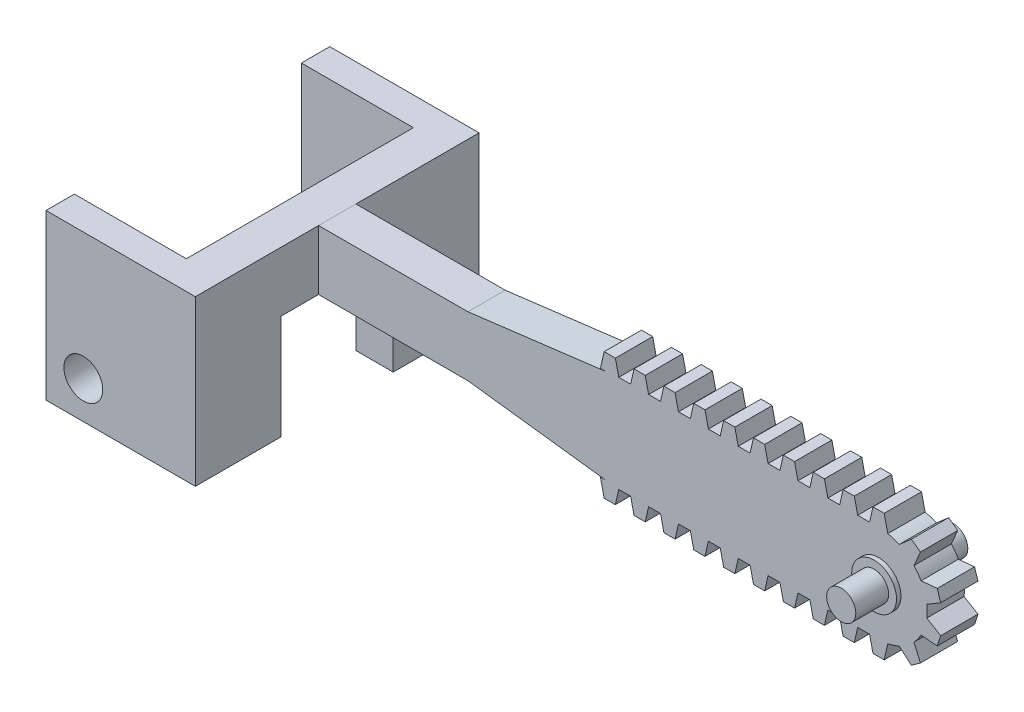
from build123d import *

# Parameters (mm, degrees)
BOSS_EXTRU_1_DEPTH           = 2.5
ESQUISSE2_R                  = 1.95
BOSS_EXTRU_2_DEPTH           = 7.5
BOSS_EXTRU_3_DEPTH           = 2.5
R_P_TITION_LIN_AIRE1_COUNT   = 10
R_P_TITION_LIN_AIRE1_PITCH   = 4
SYM_TRIE1_COPY_1_DEPTH       = 2.5
SYM_TRIE1_COPY_2_DEPTH       = 2.5
SYM_TRIE1_COPY_3_DEPTH       = 2.5
SYM_TRIE1_COPY_4_DEPTH       = 2.5
SYM_TRIE1_COPY_5_DEPTH       = 2.5
SYM_TRIE1_COPY_6_DEPTH       = 2.5
SYM_TRIE1_COPY_7_DEPTH       = 2.5
SYM_TRIE1_COPY_8_DEPTH       = 2.5
SYM_TRIE1_COPY_9_DEPTH       = 2.5
SYM_TRIE1_COPY_10_DEPTH      = 2.5
R_P_TITION_CIRCULAIRE1_COUNT = 6
R_P_TITION_CIRCULAIRE1_ANGLE = 180
ESQUISSE6_R                  = 3
BOSS_EXTRU_4_DEPTH           = 0.6
BOSS_EXTRU_5_START           = 0.6
ESQUISSE7_R                  = 3
BOSS_EXTRU_5_DEPTH           = 0.6
BOSS_EXTRU_6_DEPTH           = 22
ESQUISSE11_R                 = 2.6
ENL_V_MAT_EXTRU_5_DEPTH      = 89.17170748
ESQUISSE12_W                 = 15
ESQUISSE12_H                 = 14
ENL_V_MAT_EXTRU_6_DEPTH      = 88.329909275


with BuildPart() as part:
    # Esquisse1 → Boss.-Extru.1 (new, symmetric)
    with BuildSketch(Plane.XY):
        with BuildLine():
            Line((-17.5, 6.5), (-37.5, 4))
            Line((-37.5, 4), (-57.5, 4))
            Line((-57.5, 4), (-57.5, -4))
            Line((-57.5, -4), (-37.5, -4))
            Line((-37.5, -4), (-17.5, -6.5))
            Line((-17.5, -6.5), (17.5, -6.5))
            ThreePointArc((17.5, -6.5), (24, 0), (17.5, 6.5))
            Line((17.5, 6.5), (-17.5, 6.5))
        make_face()
    extrude(amount=BOSS_EXTRU_1_DEPTH, both=True)

    # Esquisse2 → Boss.-Extru.2 (add, symmetric)
    with BuildSketch(Plane.XY):
        with Locations((17.5, 0)):
            Circle(ESQUISSE2_R)
    extrude(amount=BOSS_EXTRU_2_DEPTH, both=True)

    # Esquisse5 → Boss.-Extru.3 (add, symmetric)
    with BuildSketch(Plane.XY):
        Polygon((16.25, -6.3), (16.75, -8.5), (18.25, -8.5), (18.75, -6.3), align=None)
    boss_extru_3 = extrude(amount=BOSS_EXTRU_3_DEPTH, both=True)

    # Répétition linéaire1: Boss.-Extru.3 ×10
    with Locations(*[(-i * R_P_TITION_LIN_AIRE1_PITCH, 0, 0) for i in range(1, R_P_TITION_LIN_AIRE1_COUNT)]):
        add(boss_extru_3)

    # Symétrie1 copy 1 sketch → Symétrie1 copy 1 (add, symmetric)
    with BuildSketch(Plane(origin=(-4, 0, 0), x_dir=(1, 0, 0), z_dir=(0, 0, 1))):
        Polygon((16.25, 6.3), (16.75, 8.5), (18.25, 8.5), (18.75, 6.3), align=None)
    extrude(amount=SYM_TRIE1_COPY_1_DEPTH, both=True)

    # Symétrie1 copy 2 sketch → Symétrie1 copy 2 (add, symmetric)
    with BuildSketch(Plane(origin=(-8, 0, 0), x_dir=(1, 0, 0), z_dir=(0, 0, 1))):
        Polygon((16.25, 6.3), (16.75, 8.5), (18.25, 8.5), (18.75, 6.3), align=None)
    extrude(amount=SYM_TRIE1_COPY_2_DEPTH, both=True)

    # Symétrie1 copy 3 sketch → Symétrie1 copy 3 (add, symmetric)
    with BuildSketch(Plane(origin=(-12, 0, 0), x_dir=(1, 0, 0), z_dir=(0, 0, 1))):
        Polygon((16.25, 6.3), (16.75, 8.5), (18.25, 8.5), (18.75, 6.3), align=None)
    extrude(amount=SYM_TRIE1_COPY_3_DEPTH, both=True)

    # Symétrie1 copy 4 sketch → Symétrie1 copy 4 (add, symmetric)
    with BuildSketch(Plane(origin=(-16, 0, 0), x_dir=(1, 0, 0), z_dir=(0, 0, 1))):
        Polygon((16.25, 6.3), (16.75, 8.5), (18.25, 8.5), (18.75, 6.3), align=None)
    extrude(amount=SYM_TRIE1_COPY_4_DEPTH, both=True)

    # Symétrie1 copy 5 sketch → Symétrie1 copy 5 (add, symmetric)
    with BuildSketch(Plane(origin=(-20, 0, 0), x_dir=(1, 0, 0), z_dir=(0, 0, 1))):
        Polygon((16.25, 6.3), (16.75, 8.5), (18.25, 8.5), (18.75, 6.3), align=None)
    extrude(amount=SYM_TRIE1_COPY_5_DEPTH, both=True)

    # Symétrie1 copy 6 sketch → Symétrie1 copy 6 (add, symmetric)
    with BuildSketch(Plane(origin=(-24, 0, 0), x_dir=(1, 0, 0), z_dir=(0, 0, 1))):
        Polygon((16.25, 6.3), (16.75, 8.5), (18.25, 8.5), (18.75, 6.3), align=None)
    extrude(amount=SYM_TRIE1_COPY_6_DEPTH, both=True)

    # Symétrie1 copy 7 sketch → Symétrie1 copy 7 (add, symmetric)
    with BuildSketch(Plane(origin=(-28, 0, 0), x_dir=(1, 0, 0), z_dir=(0, 0, 1))):
        Polygon((16.25, 6.3), (16.75, 8.5), (18.25, 8.5), (18.75, 6.3), align=None)
    extrude(amount=SYM_TRIE1_COPY_7_DEPTH, both=True)

    # Symétrie1 copy 8 sketch → Symétrie1 copy 8 (add, symmetric)
    with BuildSketch(Plane(origin=(-32, 0, 0), x_dir=(1, 0, 0), z_dir=(0, 0, 1))):
        Polygon((16.25, 6.3), (16.75, 8.5), (18.25, 8.5), (18.75, 6.3), align=None)
    extrude(amount=SYM_TRIE1_COPY_8_DEPTH, both=True)

    # Symétrie1 copy 9 sketch → Symétrie1 copy 9 (add, symmetric)
    with BuildSketch(Plane(origin=(-36, 0, 0), x_dir=(1, 0, 0), z_dir=(0, 0, 1))):
        Polygon((16.25, 6.3), (16.75, 8.5), (18.25, 8.5), (18.75, 6.3), align=None)
    extrude(amount=SYM_TRIE1_COPY_9_DEPTH, both=True)

    # Symétrie1 copy 10 sketch → Symétrie1 copy 10 (add, symmetric)
    with BuildSketch(Plane.XY):
        Polygon((16.25, 6.3), (16.75, 8.5), (18.25, 8.5), (18.75, 6.3), align=None)
    extrude(amount=SYM_TRIE1_COPY_10_DEPTH, both=True)

    # Répétition circulaire1: Boss.-Extru.3 ×6 about axis
    r_p_tition_circulaire1_axis = Axis((17.5, 0, 2.5), (0, 0, 1))
    for i in range(1, R_P_TITION_CIRCULAIRE1_COUNT):
        add(boss_extru_3.rotate(r_p_tition_circulaire1_axis, i * R_P_TITION_CIRCULAIRE1_ANGLE / (R_P_TITION_CIRCULAIRE1_COUNT - 1)))

    # Esquisse6 → Boss.-Extru.4 (add)
    with BuildSketch(Plane.XY.offset(2.5)):
        with Locations((17.5, 0)):
            Circle(ESQUISSE6_R)
    extrude(amount=BOSS_EXTRU_4_DEPTH)

    # Esquisse7 → Boss.-Extru.5 (add)
    with BuildSketch(Plane(origin=(0, 0, -2.5), x_dir=(-1, 0, 0), z_dir=(0, 0, -1)).offset(BOSS_EXTRU_5_START)):
        with Locations((-17.5, 0)):
            Circle(ESQUISSE7_R)
    extrude(amount=-BOSS_EXTRU_5_DEPTH)


with BuildPart() as body_2:
    # Esquisse10 → Boss.-Extru.6 (new body)
    with BuildSketch(Plane(origin=(0, 4, 0), x_dir=(1, 0, 0), z_dir=(0, 1, 0))):
        Polygon((-57.5, -19), (-77.5, -19), (-77.5, -15.2), (-62.5, -15.2), (-62.5, 15.2), (-77.5, 15.2), (-77.5, 19), (-57.5, 19), align=None)
    extrude(amount=-BOSS_EXTRU_6_DEPTH)

    # Esquisse11 → Enlèv. mat.-Extru.5 (cut, through all)
    with BuildSketch(Plane.XY.offset(19)):
        with Locations((-72.5, -13)):
            Circle(ESQUISSE11_R)
    extrude(amount=-ENL_V_MAT_EXTRU_5_DEPTH, mode=Mode.SUBTRACT)

    # Esquisse12 → Enlèv. mat.-Extru.6 (cut, through all)
    with BuildSketch(Plane(origin=(-57.5, 0, 0), x_dir=(0, 0, -1), z_dir=(1, 0, 0))):
        with Locations((0, -11)):
            Rectangle(ESQUISSE12_W, ESQUISSE12_H)
    extrude(amount=-ENL_V_MAT_EXTRU_6_DEPTH, mode=Mode.SUBTRACT)


solid = Compound([part.part, body_2.part])
